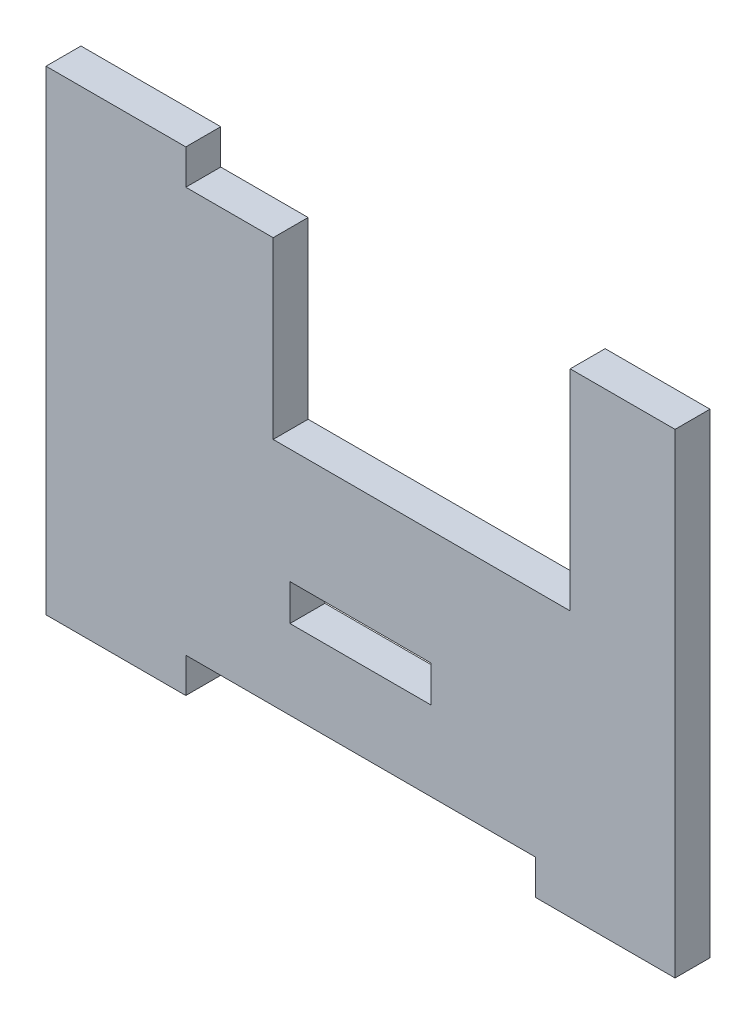
from build123d import *

# Parameters (mm, degrees)
SKETCH2_W           = 25.654
SKETCH2_H           = 6.604
BOSS_EXTRUDE1_DEPTH = 6.35


with BuildPart() as part:
    # Sketch2 → Boss-Extrude1 (new body)
    with BuildSketch(Plane(origin=(0, 0, 0), x_dir=(1, 0, 0), z_dir=(0, 0, -1))):
        Polygon((-82.55, 0), (-82.55, 73.64), (-82.55, 79.99), (-107.95, 79.99), (-107.95, 73.64), (-171.45, 73.64), (-171.45, 79.99), (-196.85, 79.99), (-196.85, 73.64), (-196.85, 0), (-196.85, -6.35), (-171.45, -6.35), (-171.45, 0), (-155.575, 0), (-155.575, 31.75), (-101.6, 31.75), (-101.6, 0), (-101.6, -6.35), (-82.55, -6.35), align=None)
        with Locations((-139.7, 55.895)):
            Rectangle(SKETCH2_W, SKETCH2_H, mode=Mode.SUBTRACT)
    extrude(amount=BOSS_EXTRUDE1_DEPTH)


solid = part.part
